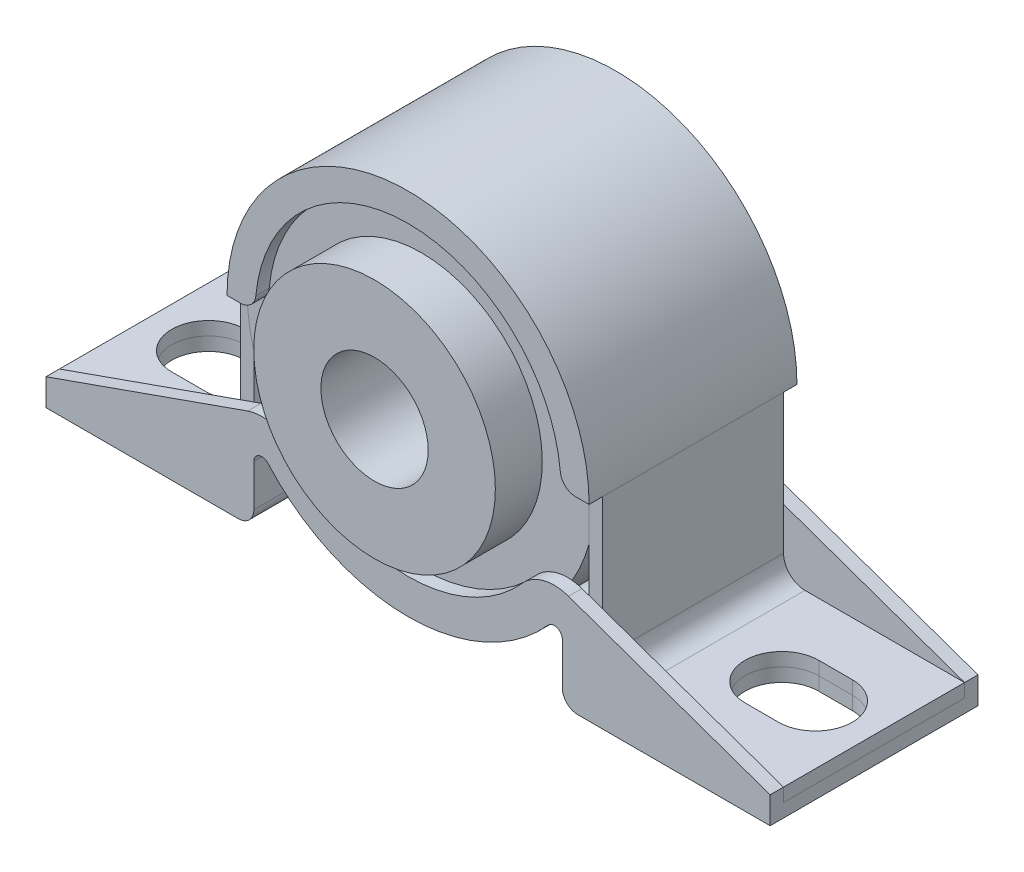
from build123d import *

# Parameters (mm, degrees)
EXTRUDE_THIN2_DEPTH  = 12.303125
EXTRUDE1_DEPTH       = 1.5875
EXTRUDE_THIN3_START  = -10.715625
EXTRUDE_THIN3_DEPTH  = 21.43125
EXTRUDE2_DEPTH       = 1.5875
EXTRUDE3_START       = -10.715625
EXTRUDE3_OUTLINE_R   = 20.6375
EXTRUDE3_OUTLINE_R_2 = 14.3002
EXTRUDE3_DEPTH       = 21.43125
SKETCH8_R            = 14.3002
SKETCH8_R_2          = 6.35
EXTRUDE4_DEPTH       = 21.99894
CUT_EXTRUDE1_DEPTH   = 51.950156499


# Read off the part's stored shape, not the designer's step: Extrude-Thin3, Extrude3
with BuildPart() as part:
    # Sketch1 → Extrude-Thin2 (new, symmetric)
    with BuildSketch(Plane.XY):
        with BuildLine():
            Line((-42.8625, -20.6375), (-20.09775, -20.6375))
            ThreePointArc((-20.09775, -20.6375), (-19.918144878, -20.563105122), (-19.84375, -20.3835))
            Line((-19.84375, -20.3835), (-19.84375, -15.420011096))
            ThreePointArc((-19.84375, -15.420011096), (-18.207905551, -13.0463846), (-15.40744863, -13.730146866))
            ThreePointArc((-15.40744863, -13.730146866), (0, -20.6375), (15.40744863, -13.730146866))
            ThreePointArc((15.40744863, -13.730146866), (18.207905551, -13.0463846), (19.84375, -15.420011096))
            Line((19.84375, -15.420011096), (19.84375, -20.3835))
            ThreePointArc((19.84375, -20.3835), (19.918144878, -20.563105122), (20.09775, -20.6375))
            Line((20.09775, -20.6375), (42.8625, -20.6375))
            Line((42.8625, -20.6375), (42.8625, -22.225))
            Line((42.8625, -22.225), (20.09775, -22.225))
            ThreePointArc((20.09775, -22.225), (18.795612862, -21.685637138), (18.25625, -20.3835))
            Line((18.25625, -20.3835), (18.25625, -15.420011096))
            ThreePointArc((18.25625, -15.420011096), (17.642808332, -14.52990116), (16.592636986, -14.786312009))
            ThreePointArc((16.592636986, -14.786312009), (0, -22.225), (-16.592636986, -14.786312009))
            ThreePointArc((-16.592636986, -14.786312009), (-17.642808332, -14.52990116), (-18.25625, -15.420011096))
            Line((-18.25625, -15.420011096), (-18.25625, -20.3835))
            ThreePointArc((-18.25625, -20.3835), (-18.795612862, -21.685637138), (-20.09775, -22.225))
            Line((-20.09775, -22.225), (-42.8625, -22.225))
            Line((-42.8625, -22.225), (-42.8625, -20.6375))
        make_face()
    extrude(amount=EXTRUDE_THIN2_DEPTH, both=True)

    # Sketch4 → Extrude1 (add)
    with BuildSketch(Plane.XY.offset(12.303125)):
        with BuildLine():
            Line((-42.8625, -19.05), (-18.993828558, -10.629391671))
            ThreePointArc((-18.993828558, -10.629391671), (-16.037730525, -10.500296197), (-13.51114726, -12.040282636))
            ThreePointArc((-13.51114726, -12.040282636), (0, -18.0975), (13.51114726, -12.040282636))
            ThreePointArc((13.51114726, -12.040282636), (16.037730525, -10.500296197), (18.993828558, -10.629391671))
            Line((18.993828558, -10.629391671), (42.8625, -19.05))
            Line((42.8625, -19.05), (42.8625, -22.225))
            Line((42.8625, -22.225), (20.09775, -22.225))
            ThreePointArc((20.09775, -22.225), (18.795612862, -21.685637138), (18.25625, -20.3835))
            Line((18.25625, -20.3835), (18.25625, -15.420011096))
            ThreePointArc((18.25625, -15.420011096), (17.642808332, -14.52990116), (16.592636986, -14.786312009))
            ThreePointArc((16.592636986, -14.786312009), (0, -22.225), (-16.592636986, -14.786312009))
            ThreePointArc((-16.592636986, -14.786312009), (-17.642808332, -14.52990116), (-18.25625, -15.420011096))
            Line((-18.25625, -15.420011096), (-18.25625, -20.3835))
            ThreePointArc((-18.25625, -20.3835), (-18.795612862, -21.685637138), (-20.09775, -22.225))
            Line((-20.09775, -22.225), (-42.8625, -22.225))
            Line((-42.8625, -22.225), (-42.8625, -19.05))
        make_face()
    extrude1 = extrude(amount=-EXTRUDE1_DEPTH)

    # Mirror1: Extrude1 across plane
    add(extrude1.mirror(Plane.XY))


with BuildPart() as body_2:
    # Extrude-Thin3 outline → Extrude-Thin3 (new body)
    with BuildSketch(Plane.XY.offset(EXTRUDE_THIN3_START)):
        with BuildLine():
            Line((-23.97125, -19.05), (-42.8625, -19.05))
            Line((-42.8625, -19.05), (-42.8625, -20.6375))
            Line((-42.8625, -20.6375), (-23.97125, -20.6375))
            ThreePointArc((-23.97125, -20.6375), (-21.052666761, -19.428583239), (-19.84375, -16.51))
            Line((-19.84375, -16.51), (-19.84375, 0))
            ThreePointArc((-19.84375, 0), (0, 19.84375), (19.84375, 0))
            Line((19.84375, 0), (19.84375, -16.51))
            ThreePointArc((19.84375, -16.51), (21.052666761, -19.428583239), (23.97125, -20.6375))
            Line((23.97125, -20.6375), (42.8625, -20.6375))
            Line((42.8625, -20.6375), (42.8625, -19.05))
            Line((42.8625, -19.05), (23.97125, -19.05))
            ThreePointArc((23.97125, -19.05), (22.175198776, -18.306051224), (21.43125, -16.51))
            Line((21.43125, -16.51), (21.43125, 0))
            ThreePointArc((21.43125, 0), (0, 21.43125), (-21.43125, 0))
            Line((-21.43125, 0), (-21.43125, -16.51))
            ThreePointArc((-21.43125, -16.51), (-22.175198776, -18.306051224), (-23.97125, -19.05))
        make_face()
    extrude(amount=EXTRUDE_THIN3_DEPTH)

    # Sketch6 → Extrude2 (add)
    with BuildSketch(Plane(origin=(0, 0, -10.715625), x_dir=(-1, 0, 0), z_dir=(0, 0, -1))):
        with BuildLine():
            Line((-19.84375, 0), (-21.43125, 0))
            ThreePointArc((-21.43125, 0), (0, 21.43125), (21.43125, 0))
            Line((21.43125, 0), (19.84375, 0))
            ThreePointArc((19.84375, 0), (18.610270538, 0.477999494), (18.020989833, 1.662357273))
            ThreePointArc((18.020989833, 1.662357273), (0, 18.0975), (-18.020989833, 1.662357273))
            ThreePointArc((-18.020989833, 1.662357273), (-18.610270538, 0.477999494), (-19.84375, 0))
        make_face()
    extrude2 = extrude(amount=EXTRUDE2_DEPTH)

    # Mirror2: Extrude2 across plane
    add(extrude2.mirror(Plane.XY))


with BuildPart() as body_3:
    # Extrude3 outline → Extrude3 (new body)
    with BuildSketch(Plane.XY.offset(EXTRUDE3_START)):
        Circle(EXTRUDE3_OUTLINE_R)
        Circle(EXTRUDE3_OUTLINE_R_2, mode=Mode.SUBTRACT)
    extrude(amount=EXTRUDE3_DEPTH)


with BuildPart() as body_4:
    # Sketch8 → Extrude4 (new body)
    with BuildSketch(Plane.XY.offset(16.271875)):
        Circle(SKETCH8_R)
        Circle(SKETCH8_R_2, mode=Mode.SUBTRACT)
    extrude(amount=-EXTRUDE4_DEPTH)


with BuildPart() as cut_extrude1_tool:
    # Sketch3 → Cut-Extrude1 (new, through all)
    with BuildSketch(Plane(origin=(0, 0, 0), x_dir=(1, 0, 0), z_dir=(0, 1, 0))):
        with BuildLine():
            Line((-35.9171875, 4.365625), (-31.9484375, 4.365625))
            ThreePointArc((-31.9484375, 4.365625), (-27.5828125, 0), (-31.9484375, -4.365625))
            Line((-31.9484375, -4.365625), (-35.9171875, -4.365625))
            ThreePointArc((-35.9171875, -4.365625), (-40.2828125, 0), (-35.9171875, 4.365625))
        make_face()
        with BuildLine():
            Line((31.9484375, -4.365625), (35.9171875, -4.365625))
            ThreePointArc((35.9171875, -4.365625), (40.2828125, 0), (35.9171875, 4.365625))
            Line((35.9171875, 4.365625), (31.9484375, 4.365625))
            ThreePointArc((31.9484375, 4.365625), (27.5828125, 0), (31.9484375, -4.365625))
        make_face()
    extrude(amount=-CUT_EXTRUDE1_DEPTH)


with BuildPart() as part_1:
    add(part.part)

    # Cut-Extrude1: cut by cut_extrude1_tool
    add(cut_extrude1_tool.part, mode=Mode.SUBTRACT)


with BuildPart() as body_2_1:
    add(body_2.part)

    # Cut-Extrude1: cut by cut_extrude1_tool
    add(cut_extrude1_tool.part, mode=Mode.SUBTRACT)


solid = Compound([body_3.part, body_4.part, part_1.part, body_2_1.part])
